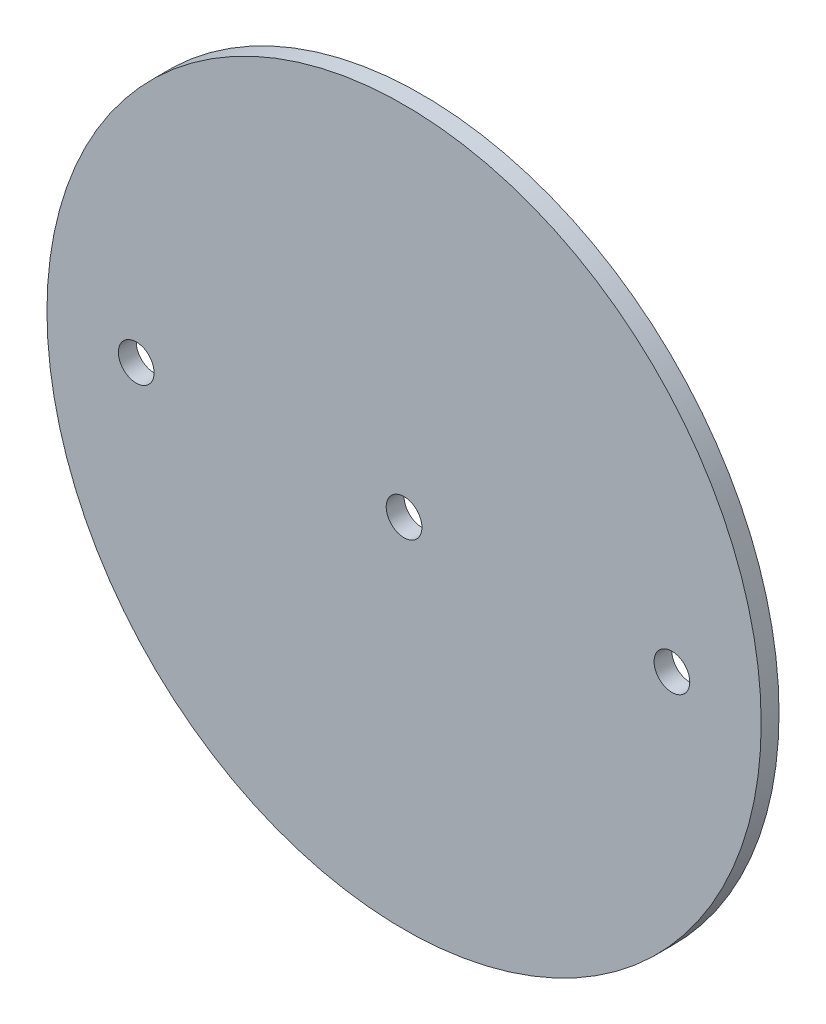
from build123d import *

# Parameters (mm, degrees)
SKETCH1_R                   = 63.5
BOSS_EXTRUDE1_DEPTH         = 1.5875
F_1_4_0_25_DIAMETER_HOLE1_D = 6.35


with BuildPart() as part:
    # Sketch1 → Boss-Extrude1 (new, symmetric)
    with BuildSketch(Plane.XY):
        Circle(SKETCH1_R)
    extrude(amount=BOSS_EXTRUDE1_DEPTH, both=True)

    # 1/4 (0.25) Diameter Hole1 (through all)
    with Locations(Plane.XY.offset(1.5875)):
        with Locations((-47.625, 0), (0, 0), (47.625, 0)):
            Hole(F_1_4_0_25_DIAMETER_HOLE1_D / 2)


solid = part.part
